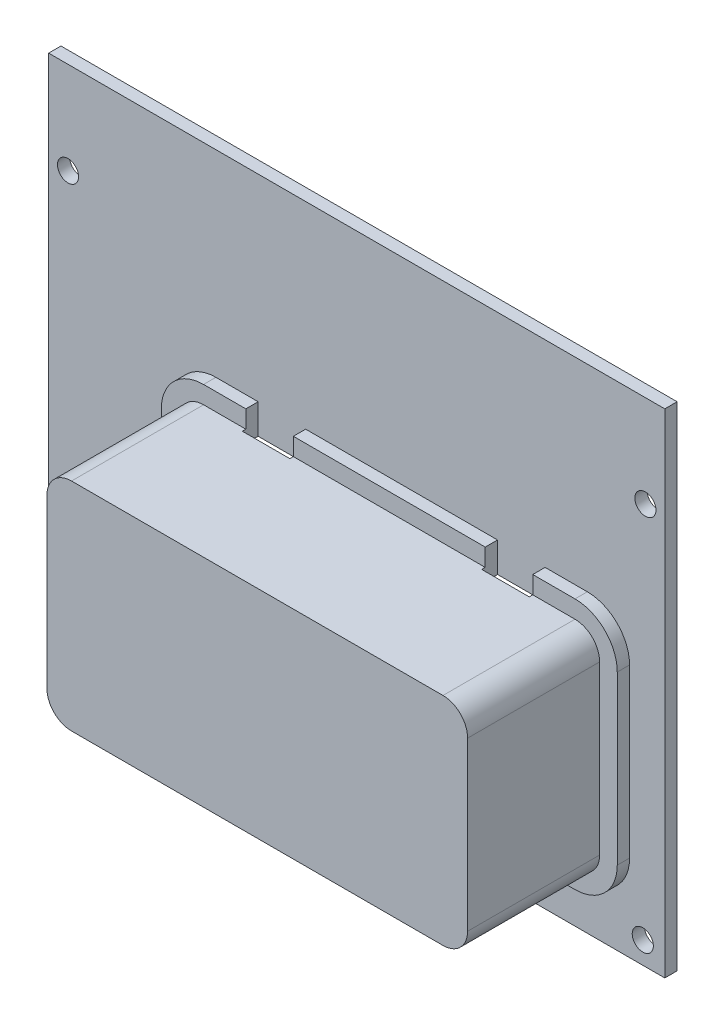
from build123d import *

# Parameters (mm, degrees)
SKETCH1_W            = 88.9
SKETCH1_H            = 71.12
BOSS_EXTRUDE1_DEPTH  = 1.778
BOSS_EXTRUDE2_DEPTH  = 19.05
SKETCH2_R            = 1.524
CUT_EXTRUDE8_DEPTH   = 1.778
BOSS_EXTRUDE8_DEPTH  = 1.778
SKETCH18_W           = 6.858
SKETCH18_H           = 2.286
CUT_EXTRUDE9_DEPTH   = 1.778
CUT_EXTRUDE20_DEPTH  = 1.778
SKETCH30_W           = 27.686
SKETCH30_H           = 2.54
BOSS_EXTRUDE18_DEPTH = 1.778
BOSS_EXTRUDE20_DEPTH = 8.89
CUT_EXTRUDE21_DEPTH  = 2.032
SKETCH20_W           = 15.24
SKETCH20_H           = 8.89
CUT_EXTRUDE22_DEPTH  = 1.778
SKETCH34_R           = 1.27
CUT_EXTRUDE23_DEPTH  = 3.81
CUT_EXTRUDE24_DEPTH  = 0.254


with BuildPart() as part:
    # Sketch1 → Boss-Extrude1 (new body)
    with BuildSketch(Plane.XY):
        Rectangle(SKETCH1_W, SKETCH1_H)
    extrude(amount=BOSS_EXTRUDE1_DEPTH)

    # Sketch3 → Boss-Extrude2 (add)
    with BuildSketch(Plane.XY.offset(1.778)):
        with BuildLine():
            Line((-20.32, 4.572), (33.274, 4.572))
            ThreePointArc((33.274, 4.572), (35.788471714, 3.530471714), (36.83, 1.016))
            Line((36.83, 1.016), (36.83, -23.114))
            ThreePointArc((36.83, -23.114), (35.788471714, -25.628471714), (33.274, -26.67))
            Line((33.274, -26.67), (-20.32, -26.67))
            ThreePointArc((-20.32, -26.67), (-22.834471714, -25.628471714), (-23.876, -23.114))
            Line((-23.876, -23.114), (-23.876, 1.016))
            ThreePointArc((-23.876, 1.016), (-22.834471714, 3.530471714), (-20.32, 4.572))
        make_face()
        with BuildLine():
            Line((-22.098, 1.016), (-22.098, -23.114))
            ThreePointArc((-22.098, -23.114), (-21.577235857, -24.371235857), (-20.32, -24.892))
            Line((-20.32, -24.892), (33.274, -24.892))
            ThreePointArc((33.274, -24.892), (34.531235857, -24.371235857), (35.052, -23.114))
            Line((35.052, -23.114), (35.052, 1.016))
            ThreePointArc((35.052, 1.016), (34.531235857, 2.273235857), (33.274, 2.794))
            Line((33.274, 2.794), (-20.32, 2.794))
            ThreePointArc((-20.32, 2.794), (-21.577235857, 2.273235857), (-22.098, 1.016))
        make_face(mode=Mode.SUBTRACT)
    extrude(amount=BOSS_EXTRUDE2_DEPTH)

    # Sketch2 → Cut-Extrude8 (cut)
    with BuildSketch(Plane(origin=(0, 0, 0), x_dir=(-1, 0, 0), z_dir=(0, 0, -1))):
        with Locations((-41.656, 22.258071702)):
            Circle(SKETCH2_R)
        with Locations((-41.275, -32.385)):
            Circle(SKETCH2_R)
        with Locations((41.275, -32.385)):
            Circle(SKETCH2_R)
        with Locations((41.656, 22.258071702)):
            Circle(SKETCH2_R)
    extrude(amount=-CUT_EXTRUDE8_DEPTH, mode=Mode.SUBTRACT)

    # Sketch17 → Boss-Extrude8 (add)
    with BuildSketch(Plane.XY.offset(20.828)):
        with BuildLine():
            Line((33.274, -26.67), (-20.32, -26.67))
            ThreePointArc((-20.32, -26.67), (-22.834471714, -25.628471714), (-23.876, -23.114))
            Line((-23.876, -23.114), (-23.876, 1.016))
            ThreePointArc((-23.876, 1.016), (-22.834471714, 3.530471714), (-20.32, 4.572))
            Line((-20.32, 4.572), (33.274, 4.572))
            ThreePointArc((33.274, 4.572), (35.788471714, 3.530471714), (36.83, 1.016))
            Line((36.83, 1.016), (36.83, -23.114))
            ThreePointArc((36.83, -23.114), (35.788471714, -25.628471714), (33.274, -26.67))
        make_face()
    extrude(amount=BOSS_EXTRUDE8_DEPTH)

    # Sketch18 → Cut-Extrude9 (cut)
    with BuildSketch(Plane(origin=(0, 4.572, 0), x_dir=(1, 0, 0), z_dir=(0, 1, 0))):
        with Locations((-10.795, -2.921)):
            Rectangle(SKETCH18_W, SKETCH18_H)
        with Locations((23.749, -2.921)):
            Rectangle(SKETCH18_W, SKETCH18_H)
    extrude(amount=-CUT_EXTRUDE9_DEPTH, mode=Mode.SUBTRACT)

    # Sketch19 → Cut-Extrude20 (cut)
    with BuildSketch(Plane(origin=(0, 0, 0), x_dir=(-1, 0, 0), z_dir=(0, 0, -1))):
        with BuildLine():
            Line((-33.274, 2.794), (20.32, 2.794))
            ThreePointArc((20.32, 2.794), (21.577235857, 2.273235857), (22.098, 1.016))
            Line((22.098, 1.016), (22.098, -23.114))
            ThreePointArc((22.098, -23.114), (21.577235857, -24.371235857), (20.32, -24.892))
            Line((20.32, -24.892), (-33.274, -24.892))
            ThreePointArc((-33.274, -24.892), (-34.531235857, -24.371235857), (-35.052, -23.114))
            Line((-35.052, -23.114), (-35.052, 1.016))
            ThreePointArc((-35.052, 1.016), (-34.531235857, 2.273235857), (-33.274, 2.794))
        make_face()
    extrude(amount=-CUT_EXTRUDE20_DEPTH, mode=Mode.SUBTRACT)

    # Sketch30 → Boss-Extrude18 (add)
    with BuildSketch(Plane.XY.offset(1.778)):
        with BuildLine():
            Line((-20.32, 4.572), (-14.224, 4.572))
            Line((-14.224, 4.572), (-14.224, 7.112))
            Line((-14.224, 7.112), (-20.32, 7.112))
            ThreePointArc((-20.32, 7.112), (-24.630522938, 5.326522938), (-26.416, 1.016))
            Line((-26.416, 1.016), (-26.416, -23.114))
            ThreePointArc((-26.416, -23.114), (-24.630522938, -27.424522938), (-20.32, -29.21))
            Line((-20.32, -29.21), (33.274, -29.21))
            ThreePointArc((33.274, -29.21), (37.584522938, -27.424522938), (39.37, -23.114))
            Line((39.37, -23.114), (39.37, 1.016))
            ThreePointArc((39.37, 1.016), (37.584522938, 5.326522938), (33.274, 7.112))
            Line((33.274, 7.112), (27.178, 7.112))
            Line((27.178, 7.112), (27.178, 4.572))
            Line((27.178, 4.572), (33.274, 4.572))
            ThreePointArc((33.274, 4.572), (35.788471714, 3.530471714), (36.83, 1.016))
            Line((36.83, 1.016), (36.83, -23.114))
            ThreePointArc((36.83, -23.114), (35.788471714, -25.628471714), (33.274, -26.67))
            Line((33.274, -26.67), (-20.32, -26.67))
            ThreePointArc((-20.32, -26.67), (-22.834471714, -25.628471714), (-23.876, -23.114))
            Line((-23.876, -23.114), (-23.876, 1.016))
            ThreePointArc((-23.876, 1.016), (-22.834471714, 3.530471714), (-20.32, 4.572))
        make_face()
        with Locations((6.477, 5.842)):
            Rectangle(SKETCH30_W, SKETCH30_H)
    extrude(amount=BOSS_EXTRUDE18_DEPTH)

    # Sketch33 → Boss-Extrude20 (add)
    with BuildSketch(Plane(origin=(0, 0, 0), x_dir=(-1, 0, 0), z_dir=(0, 0, -1))):
        with BuildLine():
            Line((-12.319, -26.67), (-0.635, -26.67))
            ThreePointArc((-0.635, -26.67), (-6.477, -32.512), (-12.319, -26.67))
        make_face()
    extrude(amount=-BOSS_EXTRUDE20_DEPTH)

    # Sketch32 → Cut-Extrude21 (cut)
    with BuildSketch(Plane(origin=(0, 0, 0), x_dir=(-1, 0, 0), z_dir=(0, 0, -1))):
        with BuildLine():
            Line((-35.052, 1.016), (-35.052, -23.114))
            ThreePointArc((-35.052, -23.114), (-34.531235857, -24.371235857), (-33.274, -24.892))
            Line((-33.274, -24.892), (20.32, -24.892))
            ThreePointArc((20.32, -24.892), (21.577235857, -24.371235857), (22.098, -23.114))
            Line((22.098, -23.114), (22.098, 1.016))
            Line((22.098, 1.016), (23.876, 1.016))
            Line((23.876, 1.016), (23.876, -23.114))
            ThreePointArc((23.876, -23.114), (22.834471714, -25.628471714), (20.32, -26.67))
            Line((20.32, -26.67), (-2.413, -26.67))
            ThreePointArc((-2.413, -26.67), (-6.477, -30.734), (-10.541, -26.67))
            Line((-10.541, -26.67), (-33.274, -26.67))
            ThreePointArc((-33.274, -26.67), (-35.788471714, -25.628471714), (-36.83, -23.114))
            Line((-36.83, -23.114), (-36.83, 1.016))
            Line((-36.83, 1.016), (-35.052, 1.016))
        make_face()
    extrude(amount=-CUT_EXTRUDE21_DEPTH, mode=Mode.SUBTRACT)

    # Sketch20 → Cut-Extrude22 (cut)
    with BuildSketch(Plane.ZY.offset(23.876)):
        with Locations((13.208, -11.049)):
            Rectangle(SKETCH20_W, SKETCH20_H)
    extrude(amount=-CUT_EXTRUDE22_DEPTH, mode=Mode.SUBTRACT)

    # Sketch34 → Cut-Extrude23 (cut)
    with BuildSketch(Plane(origin=(0, 0, 2.032), x_dir=(-1, 0, 0), z_dir=(0, 0, -1))):
        with Locations((-6.477, -27.813)):
            Circle(SKETCH34_R)
    extrude(amount=-CUT_EXTRUDE23_DEPTH, mode=Mode.SUBTRACT)

    # Sketch35 → Cut-Extrude24 (cut)
    # profile 1 of 20: a face of its own
    with BuildSketch(Plane(origin=(0, 0, 0), x_dir=(-1, 0, 0), z_dir=(0, 0, -1))):
        Polygon((-9.999366408, 20.8681916), (-10.606901508, 20.8681916), (-11.456731671, 22.853285577), (-11.70190264, 23.491017687), (-11.70190264, 21.886262252), (-11.70190264, 20.8681916), (-12.162047568, 20.8681916), (-12.162047568, 24.0431916), (-11.561702233, 24.0431916), (-10.752134751, 22.152283539), (-10.459511336, 21.420365513), (-10.459511336, 23.134405368), (-10.459511336, 24.0431916), (-9.999366408, 24.0431916), align=None)
    # profile 2 of 20: a face of its own
    with BuildSketch(Plane(origin=(0, 0, 0), x_dir=(-1, 0, 0), z_dir=(0, 0, -1))):
        with BuildLine():
            Line((-7.786356898, 20.8681916), (-7.797141544, 21.194606908))
            add(Edge.make_bspline(
                [(-7.797141544, 21.194606908), (-7.829464915, 21.163599001), (-7.892352102, 21.103271131), (-7.99221735, 21.024979555), (-8.093023965, 20.960088282), (-8.194838433, 20.908388832), (-8.298818051, 20.870216793), (-8.404494246, 20.842675681), (-8.512927147, 20.825575384), (-8.586276557, 20.823315909), (-8.623245485, 20.822177107)],
                knots=[0, 0, 0, 0, 1.153415414, 2.244043552, 3.263115803, 4.237829183, 5.17944049, 6.110916364, 7.047880616, 8, 8, 8, 8], degree=3))
            add(Edge.make_bspline(
                [(-8.623245485, 20.822177107), (-8.656345452, 20.822869918), (-8.720309679, 20.824208744), (-8.812650916, 20.834364986), (-8.897632474, 20.850590561), (-8.975400611, 20.873332964), (-9.045297556, 20.903699388), (-9.110006891, 20.936601067), (-9.166823879, 20.977108744), (-9.218645572, 21.020446608), (-9.262254377, 21.070162235), (-9.300989278, 21.12270462), (-9.332810721, 21.179987907), (-9.357598064, 21.241261089), (-9.377351426, 21.305718809), (-9.390370232, 21.37299969), (-9.399712919, 21.442875395), (-9.400682564, 21.490313147), (-9.401178003, 21.514551428)],
                knots=[0, 0, 0, 0, 1.342946427, 2.595184753, 3.764344165, 4.850470114, 5.87461288, 6.853425255, 7.789565415, 8.69989017, 9.588288839, 10.465599832, 11.345010496, 12.238980781, 13.143468724, 14.07611685, 15.016993419, 16, 16, 16, 16], degree=3))
            add(Edge.make_bspline(
                [(-9.401178003, 21.514551428), (-9.400304937, 21.544305074), (-9.398600414, 21.602394372), (-9.386595956, 21.687205554), (-9.364705965, 21.766672424), (-9.335116751, 21.841202973), (-9.297743208, 21.911268762), (-9.250085339, 21.975204457), (-9.195632216, 22.035552148), (-9.131449174, 22.089198118), (-9.060387888, 22.138865879), (-8.979616334, 22.17990362), (-8.891871848, 22.216378058), (-8.795482888, 22.244388561), (-8.691864832, 22.267896589), (-8.579960391, 22.282779832), (-8.460249986, 22.293585512), (-8.377622789, 22.294281378), (-8.334935928, 22.294640876)],
                knots=[0, 0, 0, 0, 0.955154991, 1.864789373, 2.742024524, 3.594968077, 4.434974248, 5.282906175, 6.148764718, 7.038362745, 7.96242719, 8.926004602, 9.940427878, 11.008988599, 12.143930931, 13.348431876, 14.630146952, 16, 16, 16, 16], degree=3))
            Line((-8.334935928, 22.294640876), (-7.836685249, 22.294640876))
            Line((-7.836685249, 22.294640876), (-7.836685249, 22.508176881))
            add(Edge.make_bspline(
                [(-7.836685249, 22.508176881), (-7.838206795, 22.542616504), (-7.841138171, 22.608967075), (-7.86751676, 22.703389652), (-7.912481895, 22.786181687), (-7.963120353, 22.845806481), (-8.01205405, 22.886117655), (-8.053670117, 22.912494578), (-8.099753533, 22.935022439), (-8.150265746, 22.953793919), (-8.205720074, 22.96792194), (-8.265606554, 22.977915313), (-8.3297964, 22.983514399), (-8.373989647, 22.984401192), (-8.396767903, 22.984858267)],
                knots=[0, 0, 0, 0, 1.482157561, 2.855490051, 4.181799587, 5.514928239, 6.197308866, 6.907872237, 7.633072619, 8.404323986, 9.226002842, 10.095372526, 11.018309457, 12, 12, 12, 12], degree=3))
            add(Edge.make_bspline(
                [(-8.396767903, 22.984858267), (-8.431061828, 22.984371194), (-8.499538901, 22.983398622), (-8.601782591, 22.973485277), (-8.703312125, 22.958478222), (-8.804390498, 22.937615368), (-8.905514574, 22.910163009), (-9.008469189, 22.879761938), (-9.112691312, 22.842882301), (-9.181990275, 22.814956656), (-9.217120032, 22.800800296)],
                knots=[0, 0, 0, 0, 0.972305659, 1.941470542, 2.910373234, 3.882108598, 4.866314124, 5.881229646, 6.925930714, 8, 8, 8, 8], degree=3))
            Line((-9.217120032, 22.800800296), (-9.217120032, 23.168916238))
            add(Edge.make_bspline(
                [(-9.217120032, 23.168916238), (-9.188477416, 23.180729436), (-9.128646632, 23.205405706), (-9.033289443, 23.237459066), (-8.931330112, 23.269701589), (-8.822624347, 23.296269023), (-8.709185903, 23.320727492), (-8.590770073, 23.337972214), (-8.469443797, 23.351364279), (-8.387458966, 23.35243733), (-8.346439552, 23.352974209)],
                knots=[0, 0, 0, 0, 0.83014185, 1.7340608, 2.695054669, 3.695177087, 4.731919671, 5.803820649, 6.901187094, 8, 8, 8, 8], degree=3))
            add(Edge.make_bspline(
                [(-8.346439552, 23.352974209), (-8.30974761, 23.352525525), (-8.238154711, 23.351650059), (-8.133738261, 23.34184074), (-8.034878046, 23.327284524), (-7.941972102, 23.305432986), (-7.854833062, 23.278730683), (-7.774459159, 23.244622804), (-7.700802422, 23.204756333), (-7.634717112, 23.157309782), (-7.575348679, 23.104028032), (-7.523358345, 23.044169779), (-7.478995889, 22.977592544), (-7.441694176, 22.9050717), (-7.411753833, 22.825832786), (-7.39126885, 22.739836866), (-7.379010483, 22.647293455), (-7.377380053, 22.583468635), (-7.376540322, 22.550596492)],
                knots=[0, 0, 0, 0, 1.228155586, 2.396363256, 3.508548863, 4.571322475, 5.58903266, 6.556299713, 7.49003317, 8.387405761, 9.27373179, 10.155432495, 11.034536785, 11.946112177, 12.880603898, 13.863455995, 14.899600823, 16, 16, 16, 16], degree=3))
            Line((-7.376540322, 22.550596492), (-7.376540322, 20.8681916))
            Line((-7.376540322, 20.8681916), (-7.786356898, 20.8681916))
        make_face()
        with BuildLine():
            Line((-7.836685249, 21.972539426), (-8.357224198, 21.972539426))
            add(Edge.make_bspline(
                [(-8.357224198, 21.972539426), (-8.381922125, 21.972111544), (-8.429470629, 21.971287785), (-8.498129772, 21.965406527), (-8.561650773, 21.956431933), (-8.619879497, 21.942905464), (-8.672797258, 21.925227224), (-8.721150038, 21.905778793), (-8.76394217, 21.881470523), (-8.802213116, 21.855054518), (-8.836009581, 21.825488543), (-8.863631554, 21.791756818), (-8.888986095, 21.756617869), (-8.914419893, 21.704259657), (-8.936515627, 21.631492606), (-8.939490415, 21.570583019), (-8.941033075, 21.538996627)],
                knots=[0, 0, 0, 0, 1.256799595, 2.419593437, 3.504557253, 4.519310545, 5.456558761, 6.342232071, 7.166755065, 7.955122886, 8.706685157, 9.442242139, 10.169664428, 10.906029937, 12.395534167, 14, 14, 14, 14], degree=3))
            add(Edge.make_bspline(
                [(-8.941033075, 21.538996627), (-8.940096051, 21.516391515), (-8.938238012, 21.471567489), (-8.922497523, 21.406320457), (-8.893874624, 21.346422543), (-8.853303833, 21.292216704), (-8.796561623, 21.248955398), (-8.740325055, 21.221029311), (-8.68851146, 21.205027048), (-8.644345115, 21.196877297), (-8.596339002, 21.190631471), (-8.562874325, 21.190408284), (-8.545596028, 21.19029305)],
                knots=[0, 0, 0, 0, 1.133238334, 2.247115742, 3.338776933, 4.444906553, 5.609036176, 6.883301164, 7.575401075, 8.322825507, 9.134050582, 10, 10, 10, 10], degree=3))
            add(Edge.make_bspline(
                [(-8.545596028, 21.19029305), (-8.521084856, 21.191614396), (-8.469933986, 21.194371833), (-8.390894567, 21.210942325), (-8.30752937, 21.239134328), (-8.218624567, 21.276442884), (-8.125947305, 21.326106879), (-8.031147337, 21.389584257), (-7.933118964, 21.464201458), (-7.869608767, 21.521036905), (-7.836685249, 21.550500251)],
                knots=[0, 0, 0, 0, 0.724984196, 1.512925275, 2.377872913, 3.324129438, 4.360759651, 5.480986242, 6.694149946, 8, 8, 8, 8], degree=3))
            Line((-7.836685249, 21.550500251), (-7.836685249, 21.972539426))
        make_face(mode=Mode.SUBTRACT)
    # profile 3 of 20: a face of its own
    with BuildSketch(Plane(origin=(0, 0, 0), x_dir=(-1, 0, 0), z_dir=(0, 0, -1))):
        Polygon((-4.431612785, 20.8681916), (-4.991695439, 20.8681916), (-5.61720495, 21.787043502), (-6.277944307, 20.8681916), (-6.824366408, 20.8681916), (-5.898324742, 22.104831093), (-6.778351916, 23.306959716), (-6.236962649, 23.306959716), (-5.625113691, 22.376604191), (-4.998885204, 23.306959716), (-4.477627278, 23.306959716), (-5.377066816, 22.089732588), align=None)
    # profile 4 of 20: a face of its own
    with BuildSketch(Plane(origin=(0, 0, 0), x_dir=(-1, 0, 0), z_dir=(0, 0, -1))):
        Polygon((-3.097192495, 22.938843774), (-3.787409887, 22.938843774), (-3.787409887, 23.306959716), (-2.637047568, 23.306959716), (-2.637047568, 21.236307542), (-1.946830177, 21.236307542), (-1.946830177, 20.8681916), (-3.879438872, 20.8681916), (-3.879438872, 21.236307542), (-3.097192495, 21.236307542), align=None)
    # profile 5 of 20: a face of its own
    with BuildSketch(Plane(origin=(0, 0, 0), x_dir=(-1, 0, 0), z_dir=(0, 0, -1))):
        with BuildLine():
            add(Edge.make_bspline(
                [(-2.936141771, 24.319278557), (-2.912512428, 24.318067131), (-2.866159172, 24.3156907), (-2.800224439, 24.296086669), (-2.740569824, 24.267001018), (-2.689917729, 24.226598025), (-2.647506954, 24.178911858), (-2.61581875, 24.123714893), (-2.594292604, 24.06245086), (-2.592131194, 24.019167504), (-2.591033075, 23.997177107)],
                knots=[0, 0, 0, 0, 1.079343153, 2.117328004, 3.122819929, 4.099178546, 5.062826444, 6.025974914, 6.997083423, 8, 8, 8, 8], degree=3))
            add(Edge.make_bspline(
                [(-2.591033075, 23.997177107), (-2.592210873, 23.975685538), (-2.594566983, 23.932693002), (-2.615602688, 23.87150004), (-2.64776097, 23.816147352), (-2.689614834, 23.767690265), (-2.740813184, 23.727583189), (-2.799879066, 23.697154877), (-2.866320648, 23.678951672), (-2.912545105, 23.676385591), (-2.936141771, 23.675075658)],
                knots=[0, 0, 0, 0, 0.981232231, 1.962893551, 2.926181311, 3.898235174, 4.874734994, 5.885325508, 6.920500751, 8, 8, 8, 8], degree=3))
            add(Edge.make_bspline(
                [(-2.936141771, 23.675075658), (-2.959722098, 23.676427913), (-3.006145683, 23.679090154), (-3.07282769, 23.696769029), (-3.131605031, 23.728086085), (-3.183403975, 23.767166632), (-3.224431266, 23.816444208), (-3.256727138, 23.87145614), (-3.277704903, 23.932704057), (-3.280068784, 23.975689223), (-3.281250466, 23.997177107)],
                knots=[0, 0, 0, 0, 1.079184175, 2.124635477, 3.125183358, 4.110044188, 5.074672753, 6.037679359, 7.019054161, 8, 8, 8, 8], degree=3))
            add(Edge.make_bspline(
                [(-3.281250466, 23.997177107), (-3.280148353, 24.019163666), (-3.277979082, 24.062439468), (-3.256510309, 24.123758631), (-3.224686553, 24.178612425), (-3.183096869, 24.227121657), (-3.131852204, 24.266500028), (-3.072480969, 24.296474117), (-3.006305905, 24.315550961), (-2.95975448, 24.318024089), (-2.936141771, 24.319278557)],
                knots=[0, 0, 0, 0, 1.002641448, 1.973483555, 2.936367805, 3.892548963, 4.877284659, 5.87270584, 6.920952942, 8, 8, 8, 8], degree=3))
        make_face()
    # profile 6 of 20: a face of its own
    with BuildSketch(Plane(origin=(0, 0, 0), x_dir=(-1, 0, 0), z_dir=(0, 0, -1))):
        with BuildLine():
            add(Edge.make_bspline(
                [(0.768024896, 21.532525839), (0.767428213, 21.511651633), (0.766257909, 21.470710021), (0.75839723, 21.410931981), (0.744890289, 21.354421838), (0.71862923, 21.284744792), (0.675479568, 21.203496652), (0.6059279, 21.11853681), (0.523841701, 21.04416558), (0.428958171, 20.982898404), (0.325140192, 20.93247309), (0.215210927, 20.890585253), (0.100201192, 20.859482967), (-0.017077407, 20.837076541), (-0.134993307, 20.825008438), (-0.213353977, 20.823115544), (-0.252202686, 20.822177107)],
                knots=[0, 0, 0, 0, 0.63323672, 1.2419984, 1.825711929, 2.39162918, 3.497666994, 4.599130674, 5.705956869, 6.845356182, 8.012715311, 9.202413546, 10.408945211, 11.622489052, 12.821306256, 14, 14, 14, 14], degree=3))
            add(Edge.make_bspline(
                [(-0.252202686, 20.822177107), (-0.29295108, 20.822635938), (-0.372571565, 20.823532472), (-0.48962133, 20.829236098), (-0.601659442, 20.839171901), (-0.744243159, 20.858238381), (-0.917897012, 20.893710375), (-1.051606067, 20.938026495), (-1.118569307, 20.960220586)],
                knots=[0, 0, 0, 0, 0.831729197, 1.625160497, 2.391342401, 3.126751908, 4.561039859, 6, 6, 6, 6], degree=3))
            Line((-1.118569307, 20.960220586), (-1.118569307, 21.328336528))
            add(Edge.make_bspline(
                [(-1.118569307, 21.328336528), (-1.048636139, 21.307322702), (-0.910246064, 21.265738645), (-0.699481133, 21.223512727), (-0.49023983, 21.195136189), (-0.350793387, 21.191897977), (-0.28168072, 21.19029305)],
                knots=[0, 0, 0, 0, 1.028621383, 2.035528973, 3.026365761, 4, 4, 4, 4], degree=3))
            add(Edge.make_bspline(
                [(-0.28168072, 21.19029305), (-0.257472535, 21.190629878), (-0.210467229, 21.191283902), (-0.142545402, 21.194559852), (-0.079484429, 21.201229915), (-0.021409163, 21.209714212), (0.032027792, 21.220187667), (0.080588957, 21.23391228), (0.124194428, 21.250156818), (0.174182233, 21.274555429), (0.22682324, 21.310641359), (0.274217382, 21.365026369), (0.302697273, 21.429395008), (0.306121477, 21.475207214), (0.307879968, 21.498733946)],
                knots=[0, 0, 0, 0, 1.17661385, 2.284644417, 3.303372244, 4.257105316, 5.13653875, 5.947683424, 6.706998314, 7.394587192, 8.648397092, 9.780350192, 10.860104949, 12, 12, 12, 12], degree=3))
            add(Edge.make_bspline(
                [(0.307879968, 21.498733946), (0.306871795, 21.51970875), (0.304932917, 21.560046611), (0.286928617, 21.618369792), (0.253249809, 21.672078855), (0.211280624, 21.711732743), (0.167457458, 21.742074806), (0.125352773, 21.766506915), (0.075163689, 21.791462559), (0.015933521, 21.816636947), (-0.052796503, 21.843494076), (-0.132672732, 21.870974915), (-0.223510474, 21.90168976), (-0.288326544, 21.921214619), (-0.322662378, 21.931557769)],
                knots=[0, 0, 0, 0, 0.917773462, 1.765023339, 2.642473031, 3.66764697, 4.270919, 4.977166757, 5.799297542, 6.726223541, 7.797198263, 9.033109517, 10.428311724, 12, 12, 12, 12], degree=3))
            add(Edge.make_bspline(
                [(-0.322662378, 21.931557769), (-0.374632427, 21.948468349), (-0.475786637, 21.981383006), (-0.597435122, 22.030070006), (-0.687626637, 22.073219984), (-0.748609213, 22.10967347), (-0.805798949, 22.147662866), (-0.858570051, 22.188579761), (-0.906266671, 22.233107257), (-0.94820247, 22.281720941), (-0.985002325, 22.333746788), (-1.017035574, 22.389252714), (-1.042781029, 22.449380604), (-1.059501304, 22.515126719), (-1.07067469, 22.585444207), (-1.071917955, 22.634191345), (-1.072554814, 22.659161935)],
                knots=[0, 0, 0, 0, 2.026512324, 3.944392079, 4.85467683, 5.731183106, 6.576723802, 7.399919791, 8.204773874, 8.992414346, 9.776637271, 10.564879301, 11.365501683, 12.19338665, 13.07456718, 14, 14, 14, 14], degree=3))
            add(Edge.make_bspline(
                [(-1.072554814, 22.659161935), (-1.072030182, 22.676699488), (-1.07094518, 22.712969243), (-1.060705083, 22.767948983), (-1.046428246, 22.825543356), (-1.025728246, 22.884707717), (-0.998060887, 22.944560601), (-0.96086365, 23.002415184), (-0.915079168, 23.057683299), (-0.861571485, 23.111680691), (-0.79803599, 23.161694219), (-0.7248489, 23.208292999), (-0.640935426, 23.24842908), (-0.547680847, 23.285883617), (-0.442733053, 23.315884398), (-0.325852623, 23.338078288), (-0.196639814, 23.350706645), (-0.10651805, 23.352196965), (-0.059516997, 23.352974209)],
                knots=[0, 0, 0, 0, 0.614622147, 1.271112065, 1.956207526, 2.695343088, 3.46630398, 4.263894037, 5.10028258, 5.980076727, 6.925391825, 7.930601845, 9.017171546, 10.183335077, 11.45243841, 12.83906242, 14.35148153, 16, 16, 16, 16], degree=3))
            add(Edge.make_bspline(
                [(-0.059516997, 23.352974209), (-0.008433441, 23.351944823), (0.098987146, 23.349780189), (0.266541232, 23.332915285), (0.446163948, 23.306379488), (0.567638407, 23.276354579), (0.629981418, 23.260945223)],
                knots=[0, 0, 0, 0, 0.878855079, 1.848092334, 2.895599913, 4, 4, 4, 4], degree=3))
            Line((0.629981418, 23.260945223), (0.629981418, 22.892829281))
            add(Edge.make_bspline(
                [(0.629981418, 22.892829281), (0.565901406, 22.90725264), (0.441916486, 22.935159609), (0.28786326, 22.958870789), (0.171916831, 22.973091413), (0.09223555, 22.979048103), (0.018432529, 22.983999431), (-0.028833002, 22.984578998), (-0.051608256, 22.984858267)],
                knots=[0, 0, 0, 0, 1.715110988, 3.318474709, 4.068510855, 4.76561266, 5.405201082, 6, 6, 6, 6], degree=3))
            add(Edge.make_bspline(
                [(-0.051608256, 22.984858267), (-0.076538871, 22.984601069), (-0.124523003, 22.984106039), (-0.193398571, 22.979846182), (-0.256283108, 22.972728447), (-0.313294108, 22.962991831), (-0.364439871, 22.949569103), (-0.41092319, 22.93577116), (-0.452007507, 22.918376951), (-0.498159736, 22.89363017), (-0.545996582, 22.858276286), (-0.585480392, 22.805405773), (-0.608339921, 22.74721056), (-0.611047741, 22.706807461), (-0.612409887, 22.68648304)],
                knots=[0, 0, 0, 0, 1.269103616, 2.442652713, 3.51109931, 4.489969731, 5.38362149, 6.201703048, 6.956272417, 7.649566468, 8.867312491, 9.948294036, 10.967907512, 12, 12, 12, 12], degree=3))
            add(Edge.make_bspline(
                [(-0.612409887, 22.68648304), (-0.611060738, 22.665539586), (-0.608433442, 22.624754859), (-0.590477308, 22.56439313), (-0.551115309, 22.50955579), (-0.504280785, 22.46886946), (-0.456757187, 22.436894979), (-0.412300839, 22.412809565), (-0.362087348, 22.387569029), (-0.304631836, 22.362038019), (-0.238767635, 22.337403711), (-0.164670463, 22.310430962), (-0.081054695, 22.283429817), (-0.022153241, 22.265325666), (0.008785765, 22.255816147)],
                knots=[0, 0, 0, 0, 0.93189431, 1.814746182, 2.757480005, 3.889173945, 4.55702091, 5.301088384, 6.134940412, 7.055559415, 8.094366367, 9.260445696, 10.561001755, 12, 12, 12, 12], degree=3))
            add(Edge.make_bspline(
                [(0.008785765, 22.255816147), (0.042620882, 22.245168061), (0.107904798, 22.224622873), (0.201527725, 22.19273622), (0.286404916, 22.158968397), (0.362997292, 22.124092329), (0.432899881, 22.0894579), (0.494569592, 22.050801638), (0.550511082, 22.011768824), (0.598886605, 21.969371016), (0.642070311, 21.925956355), (0.677044822, 21.878449366), (0.707649831, 21.829517846), (0.729308468, 21.776192543), (0.746986222, 21.720455696), (0.758785245, 21.660881384), (0.767242167, 21.597955452), (0.767760769, 21.554604678), (0.768024896, 21.532525839)],
                knots=[0, 0, 0, 0, 1.488340638, 2.871711877, 4.148969093, 5.31908836, 6.402934893, 7.418779555, 8.370324581, 9.261449518, 10.114839139, 10.933391591, 11.731870306, 12.529398639, 13.340442701, 14.182560249, 15.074365781, 16, 16, 16, 16], degree=3))
        make_face()
    # profile 7 of 20: a face of its own
    with BuildSketch(Plane(origin=(0, 0, 0), x_dir=(-1, 0, 0), z_dir=(0, 0, -1))):
        Polygon((5.001358229, 23.675075658), (4.265126345, 23.675075658), (4.265126345, 24.0431916), (6.197735041, 24.0431916), (6.197735041, 23.675075658), (5.461503157, 23.675075658), (5.461503157, 21.236307542), (6.197735041, 21.236307542), (6.197735041, 20.8681916), (4.265126345, 20.8681916), (4.265126345, 21.236307542), (5.001358229, 21.236307542), align=None)
    # profile 8 of 20: a face of its own
    with BuildSketch(Plane(origin=(0, 0, 0), x_dir=(-1, 0, 0), z_dir=(0, 0, -1))):
        with BuildLine():
            Line((6.933966925, 23.306959716), (7.343783501, 23.306959716))
            Line((7.343783501, 23.306959716), (7.362476889, 22.913679598))
            add(Edge.make_bspline(
                [(7.362476889, 22.913679598), (7.379770974, 22.934229773), (7.413336357, 22.974114767), (7.465487234, 23.029209905), (7.515459367, 23.079994776), (7.580615995, 23.138115258), (7.659954817, 23.200922094), (7.756967131, 23.260874519), (7.853584042, 23.306458901), (7.953146037, 23.333969675), (8.054533142, 23.350273921), (8.123091604, 23.352068981), (8.157664842, 23.352974209)],
                knots=[0, 0, 0, 0, 0.854266791, 1.658011486, 2.412782998, 3.120041047, 4.434704301, 5.62598207, 6.741587953, 7.820291126, 8.900798085, 10, 10, 10, 10], degree=3))
            add(Edge.make_bspline(
                [(8.157664842, 23.352974209), (8.187881235, 23.352227605), (8.246571581, 23.350777451), (8.331972345, 23.341192653), (8.411111799, 23.322566605), (8.485410852, 23.299619355), (8.553128557, 23.26740205), (8.61570006, 23.229299858), (8.672233826, 23.183575821), (8.722662072, 23.130688744), (8.767687093, 23.071198564), (8.806586705, 23.004517356), (8.839426974, 22.930887594), (8.867090054, 22.850399732), (8.887611594, 22.762683694), (8.901338264, 22.668119442), (8.911381489, 22.566866313), (8.912177728, 22.496940266), (8.912590113, 22.460724435)],
                knots=[0, 0, 0, 0, 1.085064663, 2.107558619, 3.078230159, 4.000716841, 4.893799329, 5.763059749, 6.625822214, 7.496104193, 8.380689667, 9.298630169, 10.261451194, 11.271009739, 12.350052681, 13.490349789, 14.700211553, 16, 16, 16, 16], degree=3))
            Line((8.912590113, 22.460724435), (8.912590113, 20.8681916))
            Line((8.912590113, 20.8681916), (8.452445186, 20.8681916))
            Line((8.452445186, 20.8681916), (8.452445186, 22.424056636))
            add(Edge.make_bspline(
                [(8.452445186, 22.424056636), (8.452251958, 22.447074494), (8.451877071, 22.491732068), (8.446651158, 22.556286485), (8.438800377, 22.616287981), (8.428348667, 22.671922264), (8.413885625, 22.722816635), (8.396985803, 22.769314647), (8.375801452, 22.810563162), (8.352078238, 22.847520843), (8.325313764, 22.880354011), (8.295154815, 22.908558954), (8.261374476, 22.931587487), (8.225225972, 22.951458233), (8.185473764, 22.966360739), (8.142793009, 22.977113723), (8.096997769, 22.983739326), (8.065419298, 22.984477022), (8.049099398, 22.984858267)],
                knots=[0, 0, 0, 0, 1.402829076, 2.721667091, 3.944869442, 5.09095765, 6.168609952, 7.167208006, 8.101539423, 8.989006971, 9.840135635, 10.677485559, 11.496146598, 12.326328613, 13.186437782, 14.075827298, 15.005578631, 16, 16, 16, 16], degree=3))
            add(Edge.make_bspline(
                [(8.049099398, 22.984858267), (8.024561661, 22.983736166), (7.975593075, 22.981496851), (7.902334229, 22.963527927), (7.828906043, 22.930415603), (7.768696028, 22.889940421), (7.718356733, 22.849885618), (7.678109708, 22.813546834), (7.635757612, 22.772690455), (7.591660294, 22.726570027), (7.546518728, 22.673998889), (7.497513761, 22.616970465), (7.446371259, 22.553305529), (7.411995592, 22.508486482), (7.394111852, 22.485169635)],
                knots=[0, 0, 0, 0, 1.033746237, 2.062989405, 3.157602494, 4.413070739, 5.110521475, 5.869042419, 6.697918518, 7.591228405, 8.557866298, 9.618710695, 10.761148196, 12, 12, 12, 12], degree=3))
            Line((7.394111852, 22.485169635), (7.394111852, 20.8681916))
            Line((7.394111852, 20.8681916), (6.933966925, 20.8681916))
            Line((6.933966925, 20.8681916), (6.933966925, 23.306959716))
        make_face()
    # profile 9 of 20: a face of its own
    with BuildSketch(Plane(origin=(0, 0, 0), x_dir=(-1, 0, 0), z_dir=(0, 0, -1))):
        with BuildLine():
            add(Edge.make_bspline(
                [(11.5354162, 20.914206093), (11.480251171, 20.899664085), (11.369359266, 20.870431961), (11.198047427, 20.842381585), (11.022171645, 20.825581472), (10.903234846, 20.823321076), (10.84304188, 20.822177107)],
                knots=[0, 0, 0, 0, 0.976628562, 1.963203931, 2.969193748, 4, 4, 4, 4], degree=3))
            add(Edge.make_bspline(
                [(10.84304188, 20.822177107), (10.796500796, 20.823061585), (10.706036351, 20.824780791), (10.574556144, 20.840437931), (10.450995435, 20.864374359), (10.33553305, 20.898805506), (10.228349855, 20.94335048), (10.129964222, 20.998529257), (10.039281053, 21.062803673), (9.957074623, 21.136991921), (9.884022311, 21.221048491), (9.820368554, 21.314321154), (9.766979017, 21.417201518), (9.724127115, 21.529287116), (9.690422019, 21.649900524), (9.665930407, 21.779504763), (9.651736036, 21.918298587), (9.649811164, 22.013967474), (9.648821997, 22.063130459)],
                knots=[0, 0, 0, 0, 1.136400885, 2.20888441, 3.229501099, 4.207369776, 5.146701638, 6.058712657, 6.956980543, 7.856373135, 8.756755828, 9.670887347, 10.608247125, 11.581214879, 12.596799516, 13.663387589, 14.79924555, 16, 16, 16, 16], degree=3))
            add(Edge.make_bspline(
                [(9.648821997, 22.063130459), (9.649953093, 22.110629048), (9.652170949, 22.203764453), (9.668777861, 22.340028886), (9.696889157, 22.469475798), (9.735782248, 22.591944435), (9.784294183, 22.706978009), (9.843113425, 22.813541144), (9.910548672, 22.91155642), (9.987382847, 23.000570957), (10.072414561, 23.080601732), (10.165394486, 23.15128546), (10.266397483, 23.212215072), (10.374798314, 23.263084656), (10.490155109, 23.303512002), (10.611603428, 23.332093594), (10.738745185, 23.349831804), (10.825488008, 23.351914184), (10.869644008, 23.352974209)],
                knots=[0, 0, 0, 0, 1.141810988, 2.238867078, 3.294465527, 4.322239501, 5.323969771, 6.291062795, 7.243662698, 8.179259471, 9.112724635, 10.0461898, 10.981999466, 11.943445787, 12.920206053, 13.915285537, 14.938786542, 16, 16, 16, 16], degree=3))
            add(Edge.make_bspline(
                [(10.869644008, 23.352974209), (10.930568216, 23.352231586), (11.048345771, 23.35079596), (11.219569979, 23.333384883), (11.381837757, 23.307072938), (11.48463422, 23.276197733), (11.5354162, 23.260945223)],
                knots=[0, 0, 0, 0, 1.082851686, 2.093348926, 3.058104584, 4, 4, 4, 4], degree=3))
            Line((11.5354162, 23.260945223), (11.5354162, 22.846814789))
            add(Edge.make_bspline(
                [(11.5354162, 22.846814789), (11.483907145, 22.86907565), (11.382001764, 22.913116481), (11.22076023, 22.954239415), (11.05652558, 22.980836274), (10.945245307, 22.983508816), (10.889056372, 22.984858267)],
                knots=[0, 0, 0, 0, 1.009380423, 1.996955627, 2.98859944, 4, 4, 4, 4], degree=3))
            add(Edge.make_bspline(
                [(10.889056372, 22.984858267), (10.86288019, 22.984298918), (10.810713161, 22.983184181), (10.733949295, 22.970182583), (10.659160925, 22.950982456), (10.587384037, 22.923562769), (10.519010814, 22.889014845), (10.454439676, 22.847610924), (10.393786479, 22.799596011), (10.338550661, 22.74353316), (10.28705335, 22.682100392), (10.242643214, 22.612837769), (10.202829974, 22.537947302), (10.169317261, 22.456549959), (10.141419209, 22.369710032), (10.123684819, 22.276721172), (10.110406781, 22.178786522), (10.10945481, 22.111351455), (10.108966925, 22.076791011)],
                knots=[0, 0, 0, 0, 0.937127757, 1.867620338, 2.782121136, 3.700886865, 4.615024629, 5.522724867, 6.445536012, 7.380772808, 8.338570265, 9.312860305, 10.323274867, 11.374371816, 12.463618872, 13.585392888, 14.762514848, 16, 16, 16, 16], degree=3))
            add(Edge.make_bspline(
                [(10.108966925, 22.076791011), (10.109752779, 22.040825709), (10.111274843, 21.971167097), (10.12023777, 21.870141746), (10.136798384, 21.776384738), (10.1596972, 21.689460016), (10.189289589, 21.609299946), (10.224662681, 21.535400542), (10.268687236, 21.469722159), (10.317437794, 21.410020294), (10.373181846, 21.358291858), (10.434116802, 21.313466018), (10.499758775, 21.275000405), (10.570873051, 21.244226441), (10.646635297, 21.219555297), (10.72761085, 21.202483686), (10.813547908, 21.192414731), (10.872492292, 21.191012212), (10.902716925, 21.19029305)],
                knots=[0, 0, 0, 0, 1.27234413, 2.46431198, 3.583513846, 4.636374022, 5.63952714, 6.602545059, 7.526601904, 8.429693611, 9.323385565, 10.208471501, 11.101238162, 12.008498282, 12.9441488, 13.915193245, 14.930983497, 16, 16, 16, 16], degree=3))
            add(Edge.make_bspline(
                [(10.902716925, 21.19029305), (10.958187867, 21.191900595), (11.068065695, 21.19508485), (11.229779881, 21.22206159), (11.386693508, 21.264419358), (11.485763329, 21.306997007), (11.5354162, 21.328336528)],
                knots=[0, 0, 0, 0, 1.019427626, 2.019300384, 3.007291806, 4, 4, 4, 4], degree=3))
            Line((11.5354162, 21.328336528), (11.5354162, 20.914206093))
        make_face()
    # profile 10 of 20: a face of its own
    with BuildSketch(Plane(origin=(0, 0, 0), x_dir=(-1, 0, 0), z_dir=(0, 0, -1))):
        with BuildLine():
            add(Edge.make_bspline(
                [(13.37599591, 21.650437977), (13.403751979, 21.649020998), (13.458940916, 21.646203538), (13.537770288, 21.620442003), (13.60933894, 21.581801147), (13.671150753, 21.529953674), (13.722089359, 21.467543939), (13.760029893, 21.39575631), (13.786079094, 21.316650903), (13.788764373, 21.260959382), (13.790126345, 21.23271266)],
                knots=[0, 0, 0, 0, 1.017724482, 2.023598277, 3.017050526, 3.992727693, 4.969597279, 5.958861278, 6.964735074, 8, 8, 8, 8], degree=3))
            add(Edge.make_bspline(
                [(13.790126345, 21.23271266), (13.788713384, 21.20519234), (13.785903549, 21.150465045), (13.76017387, 21.072687728), (13.722066193, 21.002095305), (13.670874076, 20.941167629), (13.609329603, 20.889995211), (13.537572342, 20.852309237), (13.458963505, 20.826367674), (13.403759538, 20.823579406), (13.37599591, 20.822177107)],
                knots=[0, 0, 0, 0, 1.018327289, 2.025059896, 3.007871291, 3.98008799, 4.959151797, 5.957604889, 6.972822062, 8, 8, 8, 8], degree=3))
            add(Edge.make_bspline(
                [(13.37599591, 20.822177107), (13.347758349, 20.823557613), (13.292084889, 20.826279431), (13.213252919, 20.851930154), (13.142438999, 20.890460125), (13.081090381, 20.941116274), (13.029933018, 21.002109175), (12.991815918, 21.072683913), (12.966088792, 21.150466022), (12.963278611, 21.205192666), (12.961865476, 21.23271266)],
                knots=[0, 0, 0, 0, 1.044612106, 2.059567715, 3.042125895, 4.020937453, 4.992903667, 5.975461847, 6.981935076, 8, 8, 8, 8], degree=3))
            add(Edge.make_bspline(
                [(12.961865476, 21.23271266), (12.963227634, 21.26095904), (12.96591328, 21.316649887), (12.991959805, 21.395760213), (13.02991024, 21.467529633), (13.080812431, 21.530006343), (13.142435998, 21.581332977), (13.21305037, 21.620821484), (13.292108769, 21.64629047), (13.347766385, 21.649042267), (13.37599591, 21.650437977)],
                knots=[0, 0, 0, 0, 1.034992067, 2.04060075, 3.029604014, 4.006216132, 4.981636145, 5.95939925, 6.965007933, 8, 8, 8, 8], degree=3))
        make_face()
    # profile 11 of 20: a face of its own
    with BuildSketch(Plane(origin=(0, 0, 0), x_dir=(-1, 0, 0), z_dir=(0, 0, -1))):
        Polygon((-7.983833546, 15.942334788), (-8.262445346, 15.942334788), (-8.294246011, 17.271317818), (-8.308010478, 17.748327799), (-8.407209569, 17.464494995), (-8.720944491, 16.610623397), (-8.918393398, 16.610623397), (-9.212668212, 17.432219692), (-9.310443392, 17.748327799), (-9.317088308, 17.248535252), (-9.356008525, 15.942334788), (-9.625127589, 15.942334788), (-9.520707493, 18.038330882), (-9.182291457, 18.038330882), (-8.9003572, 17.226701959), (-8.809226935, 16.952836528), (-8.719520581, 17.226701959), (-8.418600852, 18.038330882), (-8.071166717, 18.038330882), align=None)
    # profile 12 of 20: a face of its own
    with BuildSketch(Plane(origin=(0, 0, 0), x_dir=(-1, 0, 0), z_dir=(0, 0, -1))):
        with BuildLine():
            Line((-6.619252756, 15.942334788), (-6.626372308, 16.157819894))
            add(Edge.make_bspline(
                [(-6.626372308, 16.157819894), (-6.647710783, 16.13734983), (-6.689226152, 16.097524009), (-6.75515282, 16.045839336), (-6.821700937, 16.003000957), (-6.888914394, 15.968871242), (-6.957557189, 15.943671731), (-7.027319989, 15.925490294), (-7.098902647, 15.914201426), (-7.147324719, 15.91270982), (-7.171729987, 15.911958033)],
                knots=[0, 0, 0, 0, 1.153415414, 2.244043552, 3.263115803, 4.237829183, 5.17944049, 6.110916364, 7.047880616, 8, 8, 8, 8], degree=3))
            add(Edge.make_bspline(
                [(-7.171729987, 15.911958033), (-7.193581137, 15.912415396), (-7.235807522, 15.91329923), (-7.296767166, 15.920003937), (-7.352868273, 15.930715352), (-7.404207395, 15.945728891), (-7.4503503, 15.965775476), (-7.493068572, 15.987495725), (-7.530576662, 16.014237121), (-7.564787076, 16.042846883), (-7.593575701, 16.075666965), (-7.619146788, 16.110353148), (-7.640153913, 16.148169068), (-7.656517432, 16.188618942), (-7.669557737, 16.231171109), (-7.678152184, 16.275587003), (-7.684319817, 16.321715887), (-7.684959934, 16.353032215), (-7.685287001, 16.369033268)],
                knots=[0, 0, 0, 0, 1.342946427, 2.595184753, 3.764344165, 4.850470114, 5.87461288, 6.853425255, 7.789565415, 8.69989017, 9.588288839, 10.465599832, 11.345010496, 12.238980781, 13.143468724, 14.07611685, 15.016993419, 16, 16, 16, 16], degree=3))
            add(Edge.make_bspline(
                [(-7.685287001, 16.369033268), (-7.684710641, 16.388675323), (-7.68358539, 16.427023336), (-7.675660571, 16.483011968), (-7.661209757, 16.535472519), (-7.641676253, 16.584674327), (-7.617003875, 16.630928695), (-7.585542235, 16.673136244), (-7.549594665, 16.712975149), (-7.507223829, 16.748389872), (-7.460312276, 16.781178355), (-7.40699043, 16.808269676), (-7.349065359, 16.832348504), (-7.285433585, 16.850839813), (-7.217029478, 16.866358784), (-7.143155062, 16.876184051), (-7.06412749, 16.883317488), (-7.009580629, 16.883776868), (-6.981400632, 16.884014192)],
                knots=[0, 0, 0, 0, 0.955154991, 1.864789373, 2.742024524, 3.594968077, 4.434974248, 5.282906175, 6.148764718, 7.038362745, 7.96242719, 8.926004602, 9.940427878, 11.008988599, 12.143930931, 13.348431876, 14.630146952, 16, 16, 16, 16], degree=3))
            Line((-6.981400632, 16.884014192), (-6.652477332, 16.884014192))
            Line((-6.652477332, 16.884014192), (-6.652477332, 17.024981321))
            add(Edge.make_bspline(
                [(-6.652477332, 17.024981321), (-6.65348179, 17.047716853), (-6.655416956, 17.091518597), (-6.672830946, 17.153852252), (-6.702514961, 17.208507931), (-6.735944255, 17.247869612), (-6.768248142, 17.274481285), (-6.795721248, 17.291894176), (-6.826143503, 17.306766084), (-6.859489456, 17.319158193), (-6.896097978, 17.328484895), (-6.935632412, 17.335082083), (-6.97800774, 17.338778354), (-7.007182188, 17.339363776), (-7.022219396, 17.339665517)],
                knots=[0, 0, 0, 0, 1.482157561, 2.855490051, 4.181799587, 5.514928239, 6.197308866, 6.907872237, 7.633072619, 8.404323986, 9.226002842, 10.095372526, 11.018309457, 12, 12, 12, 12], degree=3))
            add(Edge.make_bspline(
                [(-7.022219396, 17.339665517), (-7.044858745, 17.339343973), (-7.090064313, 17.338701923), (-7.157561124, 17.332157566), (-7.22458648, 17.322250566), (-7.291314, 17.308477822), (-7.35807169, 17.290354976), (-7.426037823, 17.270285519), (-7.494840709, 17.245939196), (-7.540588852, 17.227503907), (-7.563779981, 17.218158497)],
                knots=[0, 0, 0, 0, 0.972305659, 1.941470542, 2.910373234, 3.882108598, 4.866314124, 5.881229646, 6.925930714, 8, 8, 8, 8], degree=3))
            Line((-7.563779981, 17.218158497), (-7.563779981, 17.461172537))
            add(Edge.make_bspline(
                [(-7.563779981, 17.461172537), (-7.544871379, 17.468971094), (-7.505373714, 17.485261288), (-7.442423069, 17.506421514), (-7.375113979, 17.527706617), (-7.303351189, 17.545245274), (-7.228464092, 17.561391685), (-7.150291141, 17.572775896), (-7.070196842, 17.581616751), (-7.016074043, 17.582325133), (-6.98899482, 17.582679557)],
                knots=[0, 0, 0, 0, 0.83014185, 1.7340608, 2.695054669, 3.695177087, 4.731919671, 5.803820649, 6.901187094, 8, 8, 8, 8], degree=3))
            add(Edge.make_bspline(
                [(-6.98899482, 17.582679557), (-6.964772406, 17.582383356), (-6.917509906, 17.581805411), (-6.848578734, 17.575329728), (-6.783315545, 17.565720351), (-6.721983105, 17.551294922), (-6.664457724, 17.53366723), (-6.611398389, 17.5111507), (-6.562773434, 17.4848326), (-6.519146804, 17.453510462), (-6.479954361, 17.418336182), (-6.445632618, 17.378820382), (-6.416346465, 17.334869005), (-6.391721506, 17.286993916), (-6.371956202, 17.234683852), (-6.358432912, 17.177913108), (-6.350340474, 17.116819997), (-6.349264136, 17.074685643), (-6.348709782, 17.052984892)],
                knots=[0, 0, 0, 0, 1.228155586, 2.396363256, 3.508548863, 4.571322475, 5.58903266, 6.556299713, 7.49003317, 8.387405761, 9.27373179, 10.155432495, 11.034536785, 11.946112177, 12.880603898, 13.863455995, 14.899600823, 16, 16, 16, 16], degree=3))
            Line((-6.348709782, 17.052984892), (-6.348709782, 15.942334788))
            Line((-6.348709782, 15.942334788), (-6.619252756, 15.942334788))
        make_face()
        with BuildLine():
            Line((-6.652477332, 16.671376907), (-6.996114372, 16.671376907))
            add(Edge.make_bspline(
                [(-6.996114372, 16.671376907), (-7.012418863, 16.671094438), (-7.043808305, 16.670550628), (-7.089134067, 16.666668079), (-7.131067853, 16.660743445), (-7.169507909, 16.651813862), (-7.2044419, 16.640143461), (-7.23636229, 16.627304458), (-7.264611783, 16.611257202), (-7.289876587, 16.593818511), (-7.312187535, 16.574300348), (-7.330422353, 16.552032139), (-7.347160312, 16.528834942), (-7.363950592, 16.494270341), (-7.378537229, 16.446232718), (-7.380501054, 16.406022873), (-7.381519451, 16.385170919)],
                knots=[0, 0, 0, 0, 1.256799595, 2.419593437, 3.504557253, 4.519310545, 5.456558761, 6.342232071, 7.166755065, 7.955122886, 8.706685157, 9.442242139, 10.169664428, 10.906029937, 12.395534167, 14, 14, 14, 14], degree=3))
            add(Edge.make_bspline(
                [(-7.381519451, 16.385170919), (-7.380900869, 16.370248013), (-7.379674273, 16.340657152), (-7.36928309, 16.297583916), (-7.350387505, 16.258041934), (-7.323604443, 16.222257611), (-7.286145719, 16.193698389), (-7.249020797, 16.175262808), (-7.214815729, 16.164698814), (-7.18565904, 16.159318705), (-7.153967504, 16.155195484), (-7.131875588, 16.155048146), (-7.120469213, 16.154972073)],
                knots=[0, 0, 0, 0, 1.133238334, 2.247115742, 3.338776933, 4.444906553, 5.609036176, 6.883301164, 7.575401075, 8.322825507, 9.134050582, 10, 10, 10, 10], degree=3))
            add(Edge.make_bspline(
                [(-7.120469213, 16.154972073), (-7.104288009, 16.155844368), (-7.070520443, 16.157664707), (-7.018342077, 16.168603821), (-6.96330802, 16.187214948), (-6.904616959, 16.211844425), (-6.843435486, 16.244630421), (-6.780852694, 16.286535409), (-6.716138651, 16.335794421), (-6.674211997, 16.373314696), (-6.652477332, 16.392765108)],
                knots=[0, 0, 0, 0, 0.724984196, 1.512925275, 2.377872913, 3.324129438, 4.360759651, 5.480986242, 6.694149946, 8, 8, 8, 8], degree=3))
            Line((-6.652477332, 16.392765108), (-6.652477332, 16.671376907))
        make_face(mode=Mode.SUBTRACT)
    # profile 13 of 20: a face of its own
    with BuildSketch(Plane(origin=(0, 0, 0), x_dir=(-1, 0, 0), z_dir=(0, 0, -1))):
        with BuildLine():
            add(Edge.make_bspline(
                [(-5.923435212, 16.71836595), (-5.922935739, 16.751943274), (-5.921964558, 16.81723147), (-5.910442208, 16.912247056), (-5.893425068, 17.001622155), (-5.868597378, 17.085196153), (-5.837179142, 17.162620084), (-5.800379329, 17.234341255), (-5.756771248, 17.299231754), (-5.707687408, 17.358185183), (-5.652629711, 17.410315464), (-5.592069505, 17.455898823), (-5.526568662, 17.494897844), (-5.455761703, 17.526679201), (-5.380445965, 17.551978461), (-5.300771971, 17.569856278), (-5.216824638, 17.580395489), (-5.159616862, 17.581905952), (-5.130317125, 17.582679557)],
                knots=[0, 0, 0, 0, 1.213522244, 2.359588816, 3.455777217, 4.500224218, 5.506298667, 6.473544277, 7.409717521, 8.327548398, 9.242128409, 10.144912006, 11.063277635, 11.992713965, 12.946139244, 13.93155477, 14.940617791, 16, 16, 16, 16], degree=3))
            add(Edge.make_bspline(
                [(-5.130317125, 17.582679557), (-5.104663146, 17.58228844), (-5.053715145, 17.581511693), (-4.97784017, 17.573262186), (-4.902916414, 17.561741433), (-4.85414335, 17.548783691), (-4.829872033, 17.542335429)],
                knots=[0, 0, 0, 0, 1.011995225, 2.009790934, 3.009596853, 4, 4, 4, 4], degree=3))
            Line((-4.829872033, 17.542335429), (-4.829872033, 18.220591412))
            Line((-4.829872033, 18.220591412), (-4.526104483, 18.220591412))
            Line((-4.526104483, 18.220591412), (-4.526104483, 15.942334788))
            Line((-4.526104483, 15.942334788), (-4.797122094, 15.942334788))
            Line((-4.797122094, 15.942334788), (-4.80661483, 16.248000885))
            add(Edge.make_bspline(
                [(-4.80661483, 16.248000885), (-4.826190539, 16.220856909), (-4.863923698, 16.168535537), (-4.927085003, 16.099135994), (-4.992680462, 16.04092415), (-5.060547125, 15.993017142), (-5.131526972, 15.956535118), (-5.205147715, 15.930760563), (-5.281688223, 15.914956894), (-5.33370326, 15.912966087), (-5.360041334, 15.911958033)],
                knots=[0, 0, 0, 0, 1.188557225, 2.291003523, 3.326608308, 4.299853037, 5.235254321, 6.152777005, 7.064649407, 8, 8, 8, 8], degree=3))
            add(Edge.make_bspline(
                [(-5.360041334, 15.911958033), (-5.382714146, 15.912667915), (-5.426753838, 15.914046792), (-5.490669585, 15.925318846), (-5.550385737, 15.943230103), (-5.606015404, 15.968547375), (-5.656799384, 16.001068508), (-5.703403733, 16.039567399), (-5.745705788, 16.083778339), (-5.783425256, 16.133990985), (-5.816069281, 16.190155981), (-5.845021895, 16.25121266), (-5.869249138, 16.317842268), (-5.888928502, 16.389470604), (-5.904593136, 16.465725316), (-5.915256306, 16.546305526), (-5.922059382, 16.630915909), (-5.922969535, 16.688766721), (-5.923435212, 16.71836595)],
                knots=[0, 0, 0, 0, 0.982304312, 1.908028922, 2.80408564, 3.678784366, 4.548305082, 5.410655266, 6.293517043, 7.194729796, 8.126330152, 9.105012324, 10.120492729, 11.195446641, 12.322627883, 13.492405538, 14.716995279, 16, 16, 16, 16], degree=3))
        make_face()
        with BuildLine():
            add(Edge.make_bspline(
                [(-5.619667662, 16.732130417), (-5.61936609, 16.708710245), (-5.618780873, 16.663262226), (-5.615093015, 16.597363041), (-5.60860527, 16.536022925), (-5.599033923, 16.479325119), (-5.587325987, 16.427138078), (-5.573267421, 16.379418062), (-5.556285075, 16.336416006), (-5.536160788, 16.29822101), (-5.514012456, 16.264284536), (-5.489251476, 16.235126281), (-5.462187056, 16.210558364), (-5.433266644, 16.18983707), (-5.401669392, 16.174103817), (-5.367900906, 16.163165927), (-5.332150186, 16.156374337), (-5.307545154, 16.155445197), (-5.295016093, 16.154972073)],
                knots=[0, 0, 0, 0, 1.517495096, 2.944775423, 4.274950275, 5.511956765, 6.668349281, 7.738610098, 8.732293147, 9.658542409, 10.531403994, 11.353103343, 12.129562832, 12.894637768, 13.651079219, 14.40640846, 15.188531675, 16, 16, 16, 16], degree=3))
            add(Edge.make_bspline(
                [(-5.295016093, 16.154972073), (-5.27713833, 16.156039507), (-5.240188394, 16.15824569), (-5.185335563, 16.178438573), (-5.128631594, 16.207438023), (-5.071226645, 16.249769346), (-5.012630258, 16.303361034), (-4.95216737, 16.368062385), (-4.890187209, 16.443864965), (-4.850569907, 16.499775613), (-4.829872033, 16.528985868)],
                knots=[0, 0, 0, 0, 0.693108215, 1.432522877, 2.249886475, 3.166906334, 4.195069801, 5.335564095, 6.607977945, 8, 8, 8, 8], degree=3))
            Line((-4.829872033, 16.528985868), (-4.829872033, 17.274165639))
            add(Edge.make_bspline(
                [(-4.829872033, 17.274165639), (-4.85354754, 17.284133298), (-4.90226572, 17.304644209), (-4.980558017, 17.323619684), (-5.061344181, 17.33720888), (-5.116021051, 17.338851187), (-5.143132318, 17.339665517)],
                knots=[0, 0, 0, 0, 0.955121003, 1.96539641, 2.991151426, 4, 4, 4, 4], degree=3))
            add(Edge.make_bspline(
                [(-5.143132318, 17.339665517), (-5.161340224, 17.339164928), (-5.196931403, 17.338186423), (-5.248907628, 17.331867546), (-5.297477687, 17.319464235), (-5.3435491, 17.304353947), (-5.38585573, 17.283065162), (-5.425301519, 17.257762899), (-5.46152971, 17.2275432), (-5.494933888, 17.192905241), (-5.524553486, 17.153036293), (-5.550369622, 17.108181061), (-5.571309894, 17.057887826), (-5.589721766, 17.00298679), (-5.603246494, 16.942533268), (-5.61225031, 16.876944282), (-5.618875529, 16.806306647), (-5.61939715, 16.75746148), (-5.619667662, 16.732130417)],
                knots=[0, 0, 0, 0, 0.993385796, 1.941781416, 2.848094135, 3.724154444, 4.580960219, 5.423566715, 6.275490862, 7.148314694, 8.042382736, 8.977930355, 9.963790392, 11.009016528, 12.133235546, 13.336615611, 14.618771077, 16, 16, 16, 16], degree=3))
        make_face(mode=Mode.SUBTRACT)
    # profile 14 of 20: a face of its own
    with BuildSketch(Plane(origin=(0, 0, 0), x_dir=(-1, 0, 0), z_dir=(0, 0, -1))):
        with BuildLine():
            add(Edge.make_bspline(
                [(-2.703499184, 16.843670065), (-2.703558085, 16.825790384), (-2.703666007, 16.793030352), (-2.705202817, 16.747620487), (-2.707135178, 16.708063412), (-2.708839005, 16.683398675), (-2.709669462, 16.671376907)],
                knots=[0, 0, 0, 0, 1.244142988, 2.279580193, 3.161455181, 4, 4, 4, 4], degree=3))
            Line((-2.709669462, 16.671376907), (-3.827439118, 16.671376907))
            add(Edge.make_bspline(
                [(-3.827439118, 16.671376907), (-3.827189256, 16.651260312), (-3.82670182, 16.612016474), (-3.819584643, 16.554941791), (-3.809616162, 16.501310318), (-3.794720889, 16.451399988), (-3.775716094, 16.405082777), (-3.75247507, 16.362165914), (-3.724797676, 16.322921103), (-3.692747632, 16.287743504), (-3.657029249, 16.256015121), (-3.616955979, 16.229088772), (-3.57328695, 16.206212503), (-3.52620574, 16.186972336), (-3.474960086, 16.173048276), (-3.420210055, 16.16272035), (-3.361683013, 16.155717937), (-3.321339303, 16.155225376), (-3.300592274, 16.154972073)],
                knots=[0, 0, 0, 0, 1.146437208, 2.236491617, 3.275187349, 4.2543359, 5.201020221, 6.125604655, 7.031824952, 7.932503667, 8.833905166, 9.749820324, 10.678095378, 11.64148668, 12.644131567, 13.700545539, 14.817489771, 16, 16, 16, 16], degree=3))
            add(Edge.make_bspline(
                [(-3.300592274, 16.154972073), (-3.27749145, 16.155338537), (-3.231268148, 16.156071808), (-3.162205549, 16.159110125), (-3.094517643, 16.165591739), (-3.028676285, 16.173111891), (-2.965545128, 16.182103462), (-2.905263102, 16.192113222), (-2.848466703, 16.202595979), (-2.812156019, 16.211451276), (-2.794629449, 16.215725583)],
                knots=[0, 0, 0, 0, 1.085769256, 2.172556342, 3.247580209, 4.280512073, 5.286795205, 6.243888502, 7.152353877, 8, 8, 8, 8], degree=3))
            Line((-2.794629449, 16.215725583), (-2.794629449, 15.972711543))
            add(Edge.make_bspline(
                [(-2.794629449, 15.972711543), (-2.814067068, 15.96833421), (-2.854090025, 15.95932108), (-2.9162766, 15.947488237), (-2.982291534, 15.937106534), (-3.075824456, 15.925042771), (-3.197839607, 15.914388767), (-3.296769509, 15.912777747), (-3.34710668, 15.911958033)],
                knots=[0, 0, 0, 0, 0.643874705, 1.325767813, 2.045323783, 2.803189367, 4.373409836, 6, 6, 6, 6], degree=3))
            add(Edge.make_bspline(
                [(-3.34710668, 15.911958033), (-3.380212092, 15.912445435), (-3.444402009, 15.913390485), (-3.53685817, 15.924904097), (-3.622604249, 15.94123451), (-3.700818397, 15.966140563), (-3.772325583, 15.997592105), (-3.836951738, 16.035578746), (-3.895248281, 16.079555945), (-3.946384746, 16.130256906), (-3.990544353, 16.187421822), (-4.029517017, 16.249805537), (-4.06107177, 16.318926789), (-4.087261513, 16.393568085), (-4.106895927, 16.474068191), (-4.120970115, 16.559591769), (-4.129685991, 16.650154375), (-4.130691024, 16.712175615), (-4.131206668, 16.743996337)],
                knots=[0, 0, 0, 0, 1.211282521, 2.348622834, 3.406216812, 4.402772488, 5.346714289, 6.260660211, 7.14111832, 8.013537297, 8.888356594, 9.780493205, 10.700458193, 11.664046852, 12.672733138, 13.729740053, 14.835216592, 16, 16, 16, 16], degree=3))
            add(Edge.make_bspline(
                [(-4.131206668, 16.743996337), (-4.130766142, 16.772031732), (-4.129894896, 16.827478376), (-4.119713584, 16.909441987), (-4.104969286, 16.989209637), (-4.083388597, 17.06611886), (-4.056699428, 17.139891045), (-4.023299898, 17.20891984), (-3.985197235, 17.273890122), (-3.941004163, 17.333728791), (-3.891218246, 17.388288999), (-3.836116913, 17.437277515), (-3.775609781, 17.48004359), (-3.710007693, 17.51672046), (-3.639424412, 17.546361609), (-3.563969779, 17.567887248), (-3.483732241, 17.580187647), (-3.428785801, 17.581837472), (-3.400740638, 17.582679557)],
                knots=[0, 0, 0, 0, 1.0794335, 2.134835786, 3.177204417, 4.201979292, 5.208557826, 6.195419903, 7.151867908, 8.106371911, 9.055509379, 9.992415157, 10.941141569, 11.904324116, 12.882337947, 13.883643542, 14.919792435, 16, 16, 16, 16], degree=3))
            add(Edge.make_bspline(
                [(-3.400740638, 17.582679557), (-3.373505962, 17.582005034), (-3.32028963, 17.58068702), (-3.242921112, 17.57151706), (-3.170542936, 17.554540502), (-3.102853151, 17.531938561), (-3.040224728, 17.502974948), (-2.982560945, 17.468518021), (-2.930198619, 17.428525619), (-2.882883101, 17.383169191), (-2.84091826, 17.332491172), (-2.804126151, 17.276718405), (-2.773317767, 17.215426274), (-2.747748737, 17.149463278), (-2.727837213, 17.078886594), (-2.713746974, 17.00408095), (-2.705050102, 16.925196933), (-2.704023312, 16.871221812), (-2.703499184, 16.843670065)],
                knots=[0, 0, 0, 0, 1.134613766, 2.217025919, 3.238673179, 4.226640195, 5.185078325, 6.107460578, 7.019708015, 7.924063684, 8.832110714, 9.755293299, 10.701505835, 11.684380943, 12.698388095, 13.751918785, 14.852460789, 16, 16, 16, 16], degree=3))
        make_face()
        with BuildLine():
            add(Edge.make_bspline(
                [(-3.007266734, 16.884014192), (-3.006814294, 16.901581147), (-3.005928872, 16.935959608), (-3.00959512, 16.986383547), (-3.015784008, 17.034600618), (-3.026970569, 17.080252649), (-3.04116084, 17.123219066), (-3.057891015, 17.163745828), (-3.079777819, 17.200180252), (-3.103816315, 17.234191686), (-3.131413107, 17.264779978), (-3.162597147, 17.291358921), (-3.196644897, 17.31500078), (-3.234034573, 17.334868195), (-3.274681887, 17.350538743), (-3.318251748, 17.362072059), (-3.365101221, 17.368645482), (-3.397397722, 17.369567455), (-3.414030468, 17.370042272)],
                knots=[0, 0, 0, 0, 1.169206655, 2.288132893, 3.362133924, 4.401914255, 5.411157079, 6.373757216, 7.313141888, 8.233918317, 9.143664181, 10.047353367, 10.95600102, 11.898392485, 12.858800303, 13.850074949, 14.892785371, 16, 16, 16, 16], degree=3))
            add(Edge.make_bspline(
                [(-3.414030468, 17.370042272), (-3.42845386, 17.369561515), (-3.456979285, 17.368610713), (-3.498683118, 17.361824541), (-3.538606848, 17.351008289), (-3.576060432, 17.335159112), (-3.611278316, 17.315589855), (-3.644329469, 17.292696258), (-3.674883736, 17.266074737), (-3.70232591, 17.235336157), (-3.727718973, 17.201674952), (-3.749688617, 17.164237997), (-3.770596092, 17.124312419), (-3.787734642, 17.080757508), (-3.802413197, 17.034758379), (-3.814395947, 16.986605232), (-3.823033087, 16.936152366), (-3.825952555, 16.901605239), (-3.827439118, 16.884014192)],
                knots=[0, 0, 0, 0, 0.978531285, 1.935260428, 2.8600058, 3.779249664, 4.687580924, 5.590055207, 6.503133379, 7.430492965, 8.381784387, 9.359549606, 10.372750849, 11.437437409, 12.530809867, 13.647963143, 14.802366734, 16, 16, 16, 16], degree=3))
            Line((-3.827439118, 16.884014192), (-3.007266734, 16.884014192))
        make_face(mode=Mode.SUBTRACT)
    # profile 15 of 20: a face of its own
    with BuildSketch(Plane(origin=(0, 0, 0), x_dir=(-1, 0, 0), z_dir=(0, 0, -1))):
        Polygon((0.060785519, 17.309288762), (-0.394865805, 17.309288762), (-0.394865805, 17.552302802), (0.364553069, 17.552302802), (0.364553069, 16.185348828), (0.820204394, 16.185348828), (0.820204394, 15.942334788), (-0.455619315, 15.942334788), (-0.455619315, 16.185348828), (0.060785519, 16.185348828), align=None)
    # profile 16 of 20: a face of its own
    with BuildSketch(Plane(origin=(0, 0, 0), x_dir=(-1, 0, 0), z_dir=(0, 0, -1))):
        with BuildLine():
            add(Edge.make_bspline(
                [(0.167104162, 18.220591412), (0.18270322, 18.219791681), (0.213303612, 18.218222865), (0.256830838, 18.205281142), (0.296212205, 18.186080068), (0.329650502, 18.159407779), (0.35764824, 18.127927458), (0.378567406, 18.091488837), (0.392778026, 18.051045002), (0.394204894, 18.022471225), (0.394929824, 18.007954127)],
                knots=[0, 0, 0, 0, 1.079343153, 2.117328004, 3.122819929, 4.099178546, 5.062826444, 6.025974914, 6.997083423, 8, 8, 8, 8], degree=3))
            add(Edge.make_bspline(
                [(0.394929824, 18.007954127), (0.394152294, 17.993766333), (0.392596893, 17.965384541), (0.378710041, 17.924987625), (0.35748055, 17.888446202), (0.32985046, 17.856456953), (0.296051549, 17.829980017), (0.257058838, 17.809892576), (0.213197013, 17.797875617), (0.182681648, 17.796181602), (0.167104162, 17.795316842)],
                knots=[0, 0, 0, 0, 0.981232231, 1.962893551, 2.926181311, 3.898235174, 4.874734994, 5.885325508, 6.920500751, 8, 8, 8, 8], degree=3))
            add(Edge.make_bspline(
                [(0.167104162, 17.795316842), (0.151537462, 17.796209541), (0.120890642, 17.797967036), (0.076870098, 17.809637856), (0.038067869, 17.830312007), (0.003872472, 17.856111274), (-0.02321195, 17.888642174), (-0.044532272, 17.924958644), (-0.058380875, 17.965391839), (-0.059941406, 17.993768765), (-0.0607215, 18.007954127)],
                knots=[0, 0, 0, 0, 1.079184175, 2.124635477, 3.125183358, 4.110044188, 5.074672753, 6.037679359, 7.019054161, 8, 8, 8, 8], degree=3))
            add(Edge.make_bspline(
                [(-0.0607215, 18.007954127), (-0.059993934, 18.022468691), (-0.058561875, 18.051037482), (-0.044389131, 18.09151771), (-0.023380479, 18.127729785), (0.00407521, 18.159753458), (0.037904696, 18.185749336), (0.077098988, 18.205536918), (0.12078487, 18.218130616), (0.151516084, 18.219763267), (0.167104162, 18.220591412)],
                knots=[0, 0, 0, 0, 1.002641448, 1.973483555, 2.936367805, 3.892548963, 4.877284659, 5.87270584, 6.920952942, 8, 8, 8, 8], degree=3))
        make_face()
    # profile 17 of 20: a face of its own
    with BuildSketch(Plane(origin=(0, 0, 0), x_dir=(-1, 0, 0), z_dir=(0, 0, -1))):
        with BuildLine():
            Line((1.306232474, 17.552302802), (1.576775448, 17.552302802))
            Line((1.576775448, 17.552302802), (1.589116005, 17.292676474))
            add(Edge.make_bspline(
                [(1.589116005, 17.292676474), (1.600532803, 17.3062428), (1.622691201, 17.332573128), (1.657118928, 17.368944528), (1.690108344, 17.402470478), (1.733121899, 17.440839078), (1.785497918, 17.482301403), (1.849541203, 17.521879371), (1.913323461, 17.551972186), (1.979049934, 17.570133595), (2.045981266, 17.580896945), (2.091240563, 17.582081965), (2.114064302, 17.582679557)],
                knots=[0, 0, 0, 0, 0.854266791, 1.658011486, 2.412782998, 3.120041047, 4.434704301, 5.62598207, 6.741587953, 7.820291126, 8.900798085, 10, 10, 10, 10], degree=3))
            add(Edge.make_bspline(
                [(2.114064302, 17.582679557), (2.134011843, 17.582186682), (2.172756641, 17.581229354), (2.229134489, 17.574901889), (2.281378895, 17.562605787), (2.330427879, 17.547457017), (2.375132145, 17.526188561), (2.416439114, 17.501035161), (2.453760233, 17.470850152), (2.487050754, 17.435936418), (2.516774303, 17.396663604), (2.542454125, 17.352643588), (2.564133834, 17.30403644), (2.582395789, 17.250901875), (2.595943212, 17.192995584), (2.605004959, 17.130568402), (2.611635057, 17.063725516), (2.612160699, 17.017563399), (2.612432938, 16.993655292)],
                knots=[0, 0, 0, 0, 1.085064663, 2.107558619, 3.078230159, 4.000716841, 4.893799329, 5.763059749, 6.625822214, 7.496104193, 8.380689667, 9.298630169, 10.261451194, 11.271009739, 12.350052681, 13.490349789, 14.700211553, 16, 16, 16, 16], degree=3))
            Line((2.612432938, 16.993655292), (2.612432938, 15.942334788))
            Line((2.612432938, 15.942334788), (2.308665388, 15.942334788))
            Line((2.308665388, 15.942334788), (2.308665388, 16.969448816))
            add(Edge.make_bspline(
                [(2.308665388, 16.969448816), (2.308537827, 16.984644198), (2.308290344, 17.014125175), (2.304840424, 17.056741177), (2.299657682, 17.096351539), (2.292757921, 17.133078859), (2.283210053, 17.166677096), (2.27205353, 17.197373049), (2.258068548, 17.224603514), (2.24240752, 17.249001358), (2.224738786, 17.27067638), (2.204829167, 17.289296049), (2.182528865, 17.304498478), (2.158665204, 17.317616276), (2.132422536, 17.327454258), (2.104246568, 17.334552908), (2.074014554, 17.338926841), (2.053167829, 17.339413836), (2.042394145, 17.339665517)],
                knots=[0, 0, 0, 0, 1.402829076, 2.721667091, 3.944869442, 5.09095765, 6.168609952, 7.167208006, 8.101539423, 8.989006971, 9.840135635, 10.677485559, 11.496146598, 12.326328613, 13.186437782, 14.075827298, 15.005578631, 16, 16, 16, 16], degree=3))
            add(Edge.make_bspline(
                [(2.042394145, 17.339665517), (2.026195405, 17.338924755), (1.993868487, 17.337446457), (1.945506202, 17.32558416), (1.897032126, 17.303724852), (1.857284108, 17.277004908), (1.824052308, 17.250562479), (1.797482983, 17.226573204), (1.769523982, 17.19960161), (1.740412862, 17.169154921), (1.710612375, 17.134449756), (1.67826144, 17.096802085), (1.644499397, 17.05477328), (1.621806086, 17.025185706), (1.610000024, 17.009792943)],
                knots=[0, 0, 0, 0, 1.033746237, 2.062989405, 3.157602494, 4.413070739, 5.110521475, 5.869042419, 6.697918518, 7.591228405, 8.557866298, 9.618710695, 10.761148196, 12, 12, 12, 12], degree=3))
            Line((1.610000024, 17.009792943), (1.610000024, 15.942334788))
            Line((1.610000024, 15.942334788), (1.306232474, 15.942334788))
            Line((1.306232474, 15.942334788), (1.306232474, 17.552302802))
        make_face()
    # profile 18 of 20: a face of its own
    with BuildSketch(Plane(origin=(0, 0, 0), x_dir=(-1, 0, 0), z_dir=(0, 0, -1))):
        with BuildLine():
            add(Edge.make_bspline(
                [(6.318397046, 16.670902271), (6.317692914, 16.642719659), (6.316312633, 16.587474402), (6.30744451, 16.506581381), (6.291703643, 16.429891282), (6.270044224, 16.357484022), (6.241847139, 16.289842322), (6.208353914, 16.226945245), (6.168457379, 16.169369105), (6.12290507, 16.116997933), (6.071308654, 16.070355592), (6.014494018, 16.029267777), (5.952145638, 15.99408395), (5.884787009, 15.963922935), (5.811750485, 15.941019), (5.733857378, 15.923635078), (5.650519945, 15.913787942), (5.593177263, 15.912578985), (5.563724539, 15.911958033)],
                knots=[0, 0, 0, 0, 1.11533168, 2.186340517, 3.215329593, 4.209637775, 5.172397981, 6.11082755, 7.024364469, 7.938480506, 8.851566745, 9.770835784, 10.707404611, 11.680049096, 12.68592053, 13.731069016, 14.834616795, 16, 16, 16, 16], degree=3))
            add(Edge.make_bspline(
                [(5.563724539, 15.911958033), (5.531583788, 15.912585415), (5.469841713, 15.913790611), (5.380890809, 15.923224241), (5.299531874, 15.939193551), (5.225306899, 15.961344921), (5.15844856, 15.990045174), (5.098096547, 16.023890743), (5.044030045, 16.062835145), (4.996597399, 16.10743715), (4.955539248, 16.157091366), (4.920882903, 16.211641626), (4.89155804, 16.27059113), (4.868506134, 16.334351457), (4.851141033, 16.402288764), (4.838952554, 16.474051373), (4.831090526, 16.54953599), (4.830326542, 16.601268591), (4.829936052, 16.627710322)],
                knots=[0, 0, 0, 0, 1.312563004, 2.521420972, 3.648051293, 4.694693708, 5.678954229, 6.613532698, 7.515738083, 8.393474785, 9.265531829, 10.140290115, 11.027490559, 11.949473662, 12.903968408, 13.887719697, 14.920364614, 16, 16, 16, 16], degree=3))
            Line((4.829936052, 16.627710322), (4.829936052, 18.038330882))
            Line((4.829936052, 18.038330882), (5.133703601, 18.038330882))
            Line((5.133703601, 18.038330882), (5.133703601, 16.652866072))
            add(Edge.make_bspline(
                [(5.133703601, 16.652866072), (5.133953472, 16.632922719), (5.134435984, 16.59441109), (5.138799983, 16.538472672), (5.145769186, 16.486295937), (5.155645252, 16.437704037), (5.16855807, 16.392594199), (5.186538243, 16.351888129), (5.20667745, 16.314131234), (5.231695318, 16.280784658), (5.260175429, 16.25119595), (5.29266558, 16.225622364), (5.32886115, 16.203828331), (5.369076515, 16.185562599), (5.413789255, 16.171933224), (5.462759635, 16.162190388), (5.516409745, 16.155786703), (5.553737278, 16.155251419), (5.573217275, 16.154972073)],
                knots=[0, 0, 0, 0, 1.246642402, 2.407329763, 3.505429403, 4.535490685, 5.505633834, 6.431662104, 7.312644057, 8.175164385, 9.028562083, 9.873549447, 10.752251869, 11.664173984, 12.627739815, 13.667491001, 14.782741197, 16, 16, 16, 16], degree=3))
            add(Edge.make_bspline(
                [(5.573217275, 16.154972073), (5.591427813, 16.155288924), (5.626853461, 16.155905307), (5.678062679, 16.162013802), (5.725513292, 16.172624884), (5.769448587, 16.186584746), (5.809535497, 16.20525231), (5.846089945, 16.227772941), (5.879120847, 16.25427425), (5.907677227, 16.285701211), (5.932865935, 16.320476939), (5.954765053, 16.358685611), (5.973284555, 16.400207059), (5.988455018, 16.445030702), (6.000224427, 16.493156435), (6.008846593, 16.544540161), (6.013343265, 16.599310441), (6.014192845, 16.636879492), (6.014629496, 16.65618853)],
                knots=[0, 0, 0, 0, 1.143906156, 2.225283924, 3.233450169, 4.19541835, 5.116075032, 6.004390991, 6.887798474, 7.767169552, 8.663955608, 9.581332573, 10.529122189, 11.516238804, 12.550580461, 13.639017649, 14.7865465, 16, 16, 16, 16], degree=3))
            Line((6.014629496, 16.65618853), (6.014629496, 18.038330882))
            Line((6.014629496, 18.038330882), (6.318397046, 18.038330882))
            Line((6.318397046, 18.038330882), (6.318397046, 16.670902271))
        make_face()
    # profile 19 of 20: a face of its own
    with BuildSketch(Plane(origin=(0, 0, 0), x_dir=(-1, 0, 0), z_dir=(0, 0, -1))):
        with BuildLine():
            add(Edge.make_bspline(
                [(8.04987208, 16.50952576), (8.049189963, 16.485272964), (8.047866668, 16.438222948), (8.036223971, 16.369759737), (8.016807626, 16.306167792), (7.990126475, 16.247011811), (7.955803064, 16.19336616), (7.916597959, 16.143295062), (7.869783781, 16.09925231), (7.817921497, 16.059149327), (7.760201044, 16.023855921), (7.696474725, 15.994153294), (7.627616147, 15.968492906), (7.553433998, 15.94780287), (7.474591576, 15.931719163), (7.391478049, 15.920670186), (7.304510995, 15.913212896), (7.245220695, 15.91238183), (7.214985955, 15.911958033)],
                knots=[0, 0, 0, 0, 1.005643061, 1.95093061, 2.870738502, 3.757832008, 4.633806625, 5.507195241, 6.389247641, 7.292512577, 8.223494331, 9.189475669, 10.205094408, 11.269007441, 12.381228937, 13.540657028, 14.745872513, 16, 16, 16, 16], degree=3))
            add(Edge.make_bspline(
                [(7.214985955, 15.911958033), (7.187136802, 15.912270069), (7.131571838, 15.912892646), (7.048942181, 15.916709319), (6.96810373, 15.923014327), (6.890264455, 15.930596055), (6.816014276, 15.939024135), (6.74633685, 15.948771394), (6.682111073, 15.960105165), (6.641446591, 15.968656657), (6.622164596, 15.972711543)],
                knots=[0, 0, 0, 0, 1.119729043, 2.234096861, 3.324996266, 4.379512959, 5.378439906, 6.329323539, 7.207810484, 8, 8, 8, 8], degree=3))
            Line((6.622164596, 15.972711543), (6.622164596, 16.246102338))
            add(Edge.make_bspline(
                [(6.622164596, 16.246102338), (6.642808437, 16.23902913), (6.684989006, 16.224576786), (6.751153158, 16.207625499), (6.820557186, 16.191705619), (6.89386059, 16.178405551), (6.971777525, 16.167937746), (7.054605266, 16.160575866), (7.142622059, 16.15559046), (7.20295449, 16.155182041), (7.233971426, 16.154972073)],
                knots=[0, 0, 0, 0, 0.842364813, 1.72116351, 2.635659137, 3.591954833, 4.596841017, 5.670471508, 6.802388115, 8, 8, 8, 8], degree=3))
            add(Edge.make_bspline(
                [(7.233971426, 16.154972073), (7.256131534, 16.155200191), (7.298755535, 16.155638965), (7.36017455, 16.160226249), (7.416574405, 16.166206908), (7.467833604, 16.176594815), (7.514466593, 16.188551381), (7.556616939, 16.203766528), (7.59421814, 16.221873437), (7.627926142, 16.242172097), (7.656814637, 16.265625379), (7.682142208, 16.290900964), (7.702467662, 16.319097099), (7.718978183, 16.34954464), (7.731183538, 16.382346555), (7.739659393, 16.417416231), (7.744991237, 16.45462213), (7.745726881, 16.480237996), (7.74610453, 16.493388109)],
                knots=[0, 0, 0, 0, 1.523194236, 2.929797672, 4.233142745, 5.41923506, 6.522104548, 7.540643951, 8.494207191, 9.387815665, 10.238903194, 11.04655015, 11.840679357, 12.619387111, 13.4214478, 14.239285369, 15.096122854, 16, 16, 16, 16], degree=3))
            add(Edge.make_bspline(
                [(7.74610453, 16.493388109), (7.745633233, 16.507051757), (7.744712417, 16.533747652), (7.735306916, 16.572046914), (7.720601481, 16.607563437), (7.699042566, 16.639238867), (7.673707111, 16.669000627), (7.643943723, 16.696271863), (7.61108911, 16.722642579), (7.561237354, 16.755804928), (7.491480917, 16.794772014), (7.398557445, 16.833739713), (7.300017794, 16.87286564), (7.198889629, 16.913674177), (7.097787248, 16.956992601), (6.99860183, 17.002883843), (6.905577255, 17.055530626), (6.835528095, 17.107770343), (6.786586696, 17.154810513), (6.753291164, 17.192475172), (6.72472217, 17.233604665), (6.698330829, 17.276744368), (6.677683298, 17.324418413), (6.663357997, 17.376178815), (6.653851224, 17.432032059), (6.652988125, 17.470623545), (6.652541351, 17.490600018)],
                knots=[0, 0, 0, 0, 0.619815692, 1.2109895, 1.781199776, 2.357496674, 2.943929778, 3.554333405, 4.188738872, 4.856760597, 6.272963823, 7.811824644, 9.431291666, 11.092170587, 12.76691914, 14.429617761, 16.056218893, 17.616396577, 18.384212937, 19.138341755, 19.896401647, 20.65718422, 21.4332038, 22.247956952, 23.09307348, 24, 24, 24, 24], degree=3))
            add(Edge.make_bspline(
                [(6.652541351, 17.490600018), (6.653085919, 17.508512441), (6.654176394, 17.544381297), (6.663184396, 17.597977839), (6.677351693, 17.651106077), (6.697296924, 17.703572774), (6.723422652, 17.754163646), (6.755218344, 17.802664825), (6.794273087, 17.847320364), (6.839056012, 17.889426941), (6.89086601, 17.927951545), (6.949055537, 17.963094674), (7.014571269, 17.993254183), (7.086159066, 18.020623155), (7.165262135, 18.04234842), (7.251488279, 18.057912923), (7.344854371, 18.066697422), (7.409410472, 18.0680222), (7.442811617, 18.068707637)],
                knots=[0, 0, 0, 0, 0.784067079, 1.570060577, 2.373452904, 3.189297991, 4.022898002, 4.862695015, 5.722463422, 6.614650011, 7.550049647, 8.544652583, 9.586108202, 10.704431291, 11.897970904, 13.172772987, 14.537200697, 16, 16, 16, 16], degree=3))
            add(Edge.make_bspline(
                [(7.442811617, 18.068707637), (7.461487724, 18.068586635), (7.500301335, 18.068335165), (7.560106323, 18.064035926), (7.622483724, 18.058613768), (7.685911685, 18.050846478), (7.749233686, 18.041979162), (7.81139962, 18.031524695), (7.871076239, 18.020366618), (7.909713536, 18.011995262), (7.92836506, 18.007954127)],
                knots=[0, 0, 0, 0, 0.91416123, 1.89985515, 2.934260182, 3.979599391, 5.027947684, 6.064525625, 7.065681407, 8, 8, 8, 8], degree=3))
            Line((7.92836506, 18.007954127), (7.92836506, 17.764940087))
            add(Edge.make_bspline(
                [(7.92836506, 17.764940087), (7.886850026, 17.774147846), (7.804231722, 17.792472039), (7.679891078, 17.810751317), (7.557781416, 17.823552645), (7.477175198, 17.824988479), (7.437590612, 17.825693597)],
                knots=[0, 0, 0, 0, 1.029411825, 2.048613503, 3.041701399, 4, 4, 4, 4], degree=3))
            add(Edge.make_bspline(
                [(7.437590612, 17.825693597), (7.417650899, 17.825388812), (7.378999922, 17.824798021), (7.323043928, 17.821165651), (7.271232916, 17.814514102), (7.223514246, 17.805517906), (7.179756044, 17.79438498), (7.140092981, 17.780241082), (7.10474357, 17.762976591), (7.073113044, 17.743578842), (7.045665801, 17.721619582), (7.021537418, 17.698306989), (7.001392843, 17.672957082), (6.985131897, 17.645574381), (6.972406409, 17.616522954), (6.962523506, 17.585924283), (6.957507557, 17.55325896), (6.956714503, 17.530958366), (6.9563089, 17.519552863)],
                knots=[0, 0, 0, 0, 1.491437277, 2.890989782, 4.191431573, 5.395946596, 6.521058188, 7.565423013, 8.539223212, 9.458660202, 10.334655275, 11.163081303, 11.963306063, 12.748694206, 13.538083787, 14.331542868, 15.146677777, 16, 16, 16, 16], degree=3))
            add(Edge.make_bspline(
                [(6.9563089, 17.519552863), (6.956779668, 17.50589055), (6.957699448, 17.479197264), (6.96714736, 17.440736836), (6.981931417, 17.405120444), (7.002601527, 17.372456334), (7.028932263, 17.343344311), (7.057912823, 17.315026085), (7.090883781, 17.288459378), (7.140637828, 17.254443796), (7.211009725, 17.215679725), (7.303477737, 17.175009029), (7.402563854, 17.136998038), (7.503453267, 17.095789302), (7.604918646, 17.052921528), (7.687613, 17.013042254), (7.751792175, 16.97880915), (7.796768282, 16.950111444), (7.839473239, 16.919844706), (7.878740492, 16.8864065), (7.915590133, 16.851040343), (7.948530752, 16.812166449), (7.977915059, 16.770631357), (8.003251805, 16.726017231), (8.024923148, 16.678233416), (8.039055148, 16.625662222), (8.048565964, 16.569042792), (8.049426721, 16.529819867), (8.04987208, 16.50952576)],
                knots=[0, 0, 0, 0, 0.667485538, 1.304126353, 1.925325377, 2.548259058, 3.18485279, 3.841928735, 4.529978862, 5.253739616, 6.789399884, 8.452896455, 10.194043647, 11.982660287, 13.786213269, 15.583473082, 16.473910229, 17.343881083, 18.192645259, 19.033319022, 19.865571682, 20.689426309, 21.522902605, 22.351690537, 23.197589349, 24.082454772, 25.007853999, 26, 26, 26, 26], degree=3))
        make_face()
    # profile 20 of 20: a face of its own
    with BuildSketch(Plane(origin=(0, 0, 0), x_dir=(-1, 0, 0), z_dir=(0, 0, -1))):
        Polygon((10.009172776, 15.942334788), (9.698285674, 15.942334788), (9.557793182, 16.397986113), (8.687309298, 16.397986113), (8.543494348, 15.942334788), (8.247320987, 15.942334788), (8.944087804, 18.038330882), (9.334713888, 18.038330882), align=None)
        Polygon((9.483275205, 16.641000152), (9.128246882, 17.793892931), (8.764200459, 16.641000152), align=None, mode=Mode.SUBTRACT)
    extrude(amount=-CUT_EXTRUDE24_DEPTH, mode=Mode.SUBTRACT)


solid = part.part
